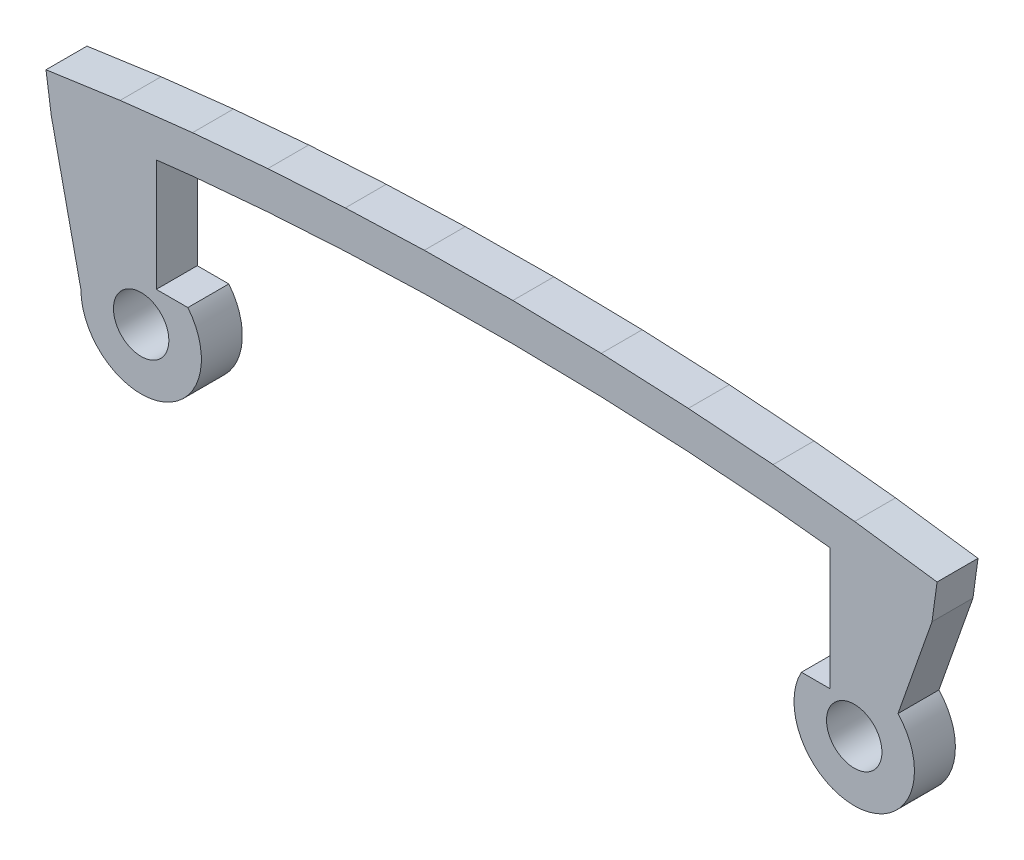
from build123d import *

# Parameters (mm, degrees)
SZKIC2_R                    = 1.15000024
DODANIE_WYCI_GNI_CIE3_DEPTH = 1.7


with BuildPart() as part:
    # Szkic2 → Dodanie-wyciągnięcie3 (new body)
    with BuildSketch(Plane.XY.offset(159.823243342)):
        with BuildLine():
            Line((-3.491319413, 146.125259602), (-1.12852765, 145.878786151))
            Line((-1.12852765, 145.878786151), (-1.12852765, 140.810063527))
            Line((-1.12852765, 140.810063527), (-2.3140149, 140.810063527))
            ThreePointArc((-2.3140149, 140.810063527), (-0.123345266, 137.105502797), (2.067324369, 140.810063527))
            ThreePointArc((2.067324369, 140.810063527), (1.896049403, 141.079288796), (1.691876928, 141.324504946))
            Line((1.691876928, 141.324504946), (3.10767961, 145.337259496))
            Line((3.10767961, 145.337259496), (3.314913021, 146.868881414))
            Line((3.314913021, 146.868881414), (-0.107320542, 147.331920709))
            Line((-0.107320542, 147.331920709), (-1.12852765, 147.438447422))
            Line((-1.12852765, 147.438447422), (-3.491319413, 147.684920873))
            Line((-3.491319413, 147.684920873), (-7.01032042, 147.947920885))
            Line((-7.01032042, 147.947920885), (-10.625318284, 148.115921106))
            Line((-10.625318284, 148.115921106), (-14.293321366, 148.183920946))
            Line((-14.293321366, 148.183920946), (-17.970319505, 148.150920953))
            Line((-17.970319505, 148.150920953), (-21.249318833, 148.03392085))
            Line((-21.249318833, 148.03392085), (-24.466319795, 147.838920679))
            Line((-24.466319795, 147.838920679), (-27.591319795, 147.56792077))
            Line((-27.591319795, 147.56792077), (-29.093820329, 147.396920766))
            Line((-29.093820329, 147.396920766), (-30.596320863, 147.225920763))
            Line((-30.596320863, 147.225920763), (-33.673352283, 146.789111574))
            Line((-33.673352283, 146.789111574), (-33.456319566, 145.260259831))
            Line((-33.456319566, 145.260259831), (-32.223326706, 139.605502797))
            ThreePointArc((-32.223326706, 139.605502797), (-28.8857443, 137.249986778), (-27.784562135, 141.183853816))
            Line((-27.784562135, 141.183853816), (-29.093820329, 141.183853816))
            Line((-29.093820329, 141.183853816), (-29.093820329, 145.837259496))
            Line((-29.093820329, 145.837259496), (-27.591319795, 146.008259499))
            Line((-27.591319795, 146.008259499), (-24.466319795, 146.279259408))
            Line((-24.466319795, 146.279259408), (-21.249318833, 146.47425958))
            Line((-21.249318833, 146.47425958), (-17.970319505, 146.591259683))
            Line((-17.970319505, 146.591259683), (-14.293321366, 146.624259675))
            Line((-14.293321366, 146.624259675), (-10.625318284, 146.556259835))
            Line((-10.625318284, 146.556259835), (-7.01032042, 146.388259614))
            Line((-7.01032042, 146.388259614), (-3.491319413, 146.125259602))
        make_face()
        with Locations((-0.123345266, 139.605502797)):
            Circle(SZKIC2_R, mode=Mode.SUBTRACT)
        with Locations((-29.723326706, 139.605502797)):
            Circle(SZKIC2_R, mode=Mode.SUBTRACT)
    extrude(amount=DODANIE_WYCI_GNI_CIE3_DEPTH)


solid = part.part
